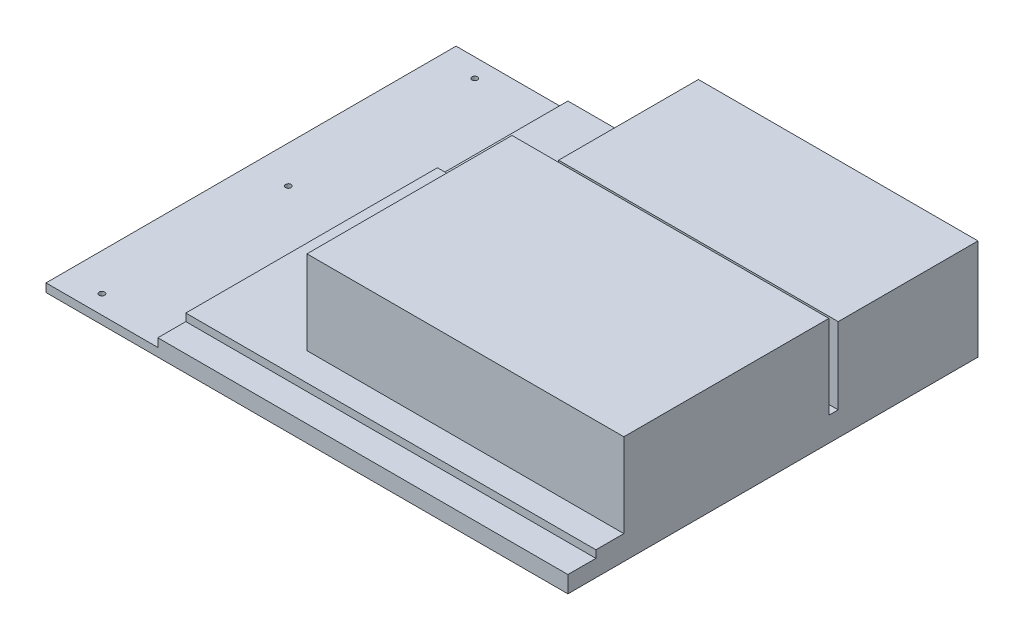
from build123d import *

# Parameters (mm, degrees)
SKETCH1_W           = 220
SKETCH1_H           = 220
BOSS_EXTRUDE1_DEPTH = 4.5
SKETCH2_W           = 220
SKETCH2_H           = 135
BOSS_EXTRUDE2_DEPTH = 4
SKETCH3_W           = 150
SKETCH3_H           = 75
BOSS_EXTRUDE3_DEPTH = 45
SKETCH4_W           = 170
SKETCH4_H           = 110
BOSS_EXTRUDE4_DEPTH = 45
SKETCH5_W           = 280
SKETCH5_H           = 220
BOSS_EXTRUDE5_DEPTH = 4.5
SKETCH6_R           = 1.5
CUT_EXTRUDE1_DEPTH  = 10


with BuildPart() as part:
    # Sketch1 → Boss-Extrude1 (new body)
    with BuildSketch(Plane(origin=(0, 0, 0), x_dir=(1, 0, 0), z_dir=(0, 1, 0))):
        with Locations((-18.301886792, -38.490566038)):
            Rectangle(SKETCH1_W, SKETCH1_H)
    extrude(amount=BOSS_EXTRUDE1_DEPTH)

    # Sketch2 → Boss-Extrude2 (add)
    with BuildSketch(Plane(origin=(0, 4.5, 0), x_dir=(1, 0, 0), z_dir=(0, 1, 0))):
        with Locations((-18.301886792, -65.990566038)):
            Rectangle(SKETCH2_W, SKETCH2_H)
    extrude(amount=BOSS_EXTRUDE2_DEPTH)

    # Sketch3 → Boss-Extrude3 (add)
    with BuildSketch(Plane(origin=(0, 4.5, 0), x_dir=(1, 0, 0), z_dir=(0, 1, 0))):
        with Locations((16.698113208, 34.009433962)):
            Rectangle(SKETCH3_W, SKETCH3_H)
    extrude(amount=BOSS_EXTRUDE3_DEPTH)

    # Sketch4 → Boss-Extrude4 (add)
    with BuildSketch(Plane(origin=(0, 8.5, 0), x_dir=(1, 0, 0), z_dir=(0, 1, 0))):
        with Locations((6.698113208, -63.490566038)):
            Rectangle(SKETCH4_W, SKETCH4_H)
    extrude(amount=BOSS_EXTRUDE4_DEPTH)

    # Sketch5 → Boss-Extrude5 (add)
    with BuildSketch(Plane.XZ):
        with Locations((-48.301886792, 38.490566038)):
            Rectangle(SKETCH5_W, SKETCH5_H)
    extrude(amount=BOSS_EXTRUDE5_DEPTH)

    # Sketch6 → Cut-Extrude1 (cut)
    with BuildSketch(Plane(origin=(0, 0, 0), x_dir=(1, 0, 0), z_dir=(0, 1, 0))):
        with Locations((-168.301886792, 61.509433962)):
            Circle(SKETCH6_R)
        with Locations((-168.301886792, -138.490566038)):
            Circle(SKETCH6_R)
        with Locations((-168.301886792, -38.490566038)):
            Circle(SKETCH6_R)
    extrude(amount=-CUT_EXTRUDE1_DEPTH, mode=Mode.SUBTRACT)


solid = part.part
